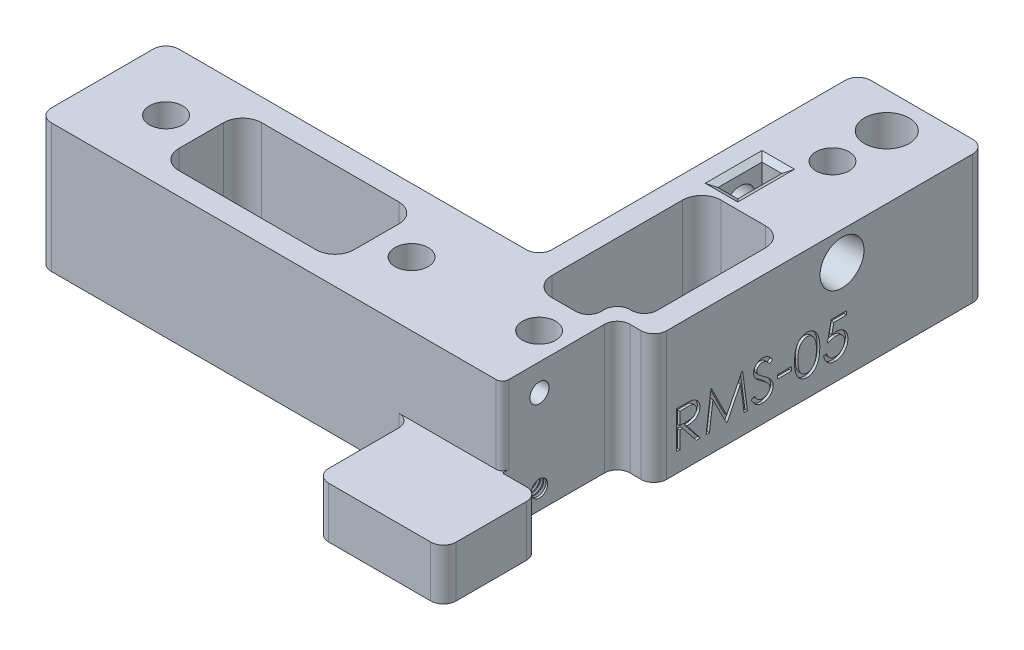
from build123d import *
from build123d.topology import SkipClean

# Parameters (mm, degrees)
SKETCH1_R                       = 2.6
BOSS_EXTRUDE1_DEPTH             = 10
SKETCH4_R                       = 2.4
MOTOR_TENSIONING_HOLE_DEPTH     = 106.651549918
SKETCH10_W                      = 20
SKETCH10_H                      = 15
BOSS_EXTRUDE3_DEPTH             = 10
FILLET1_R                       = 2
CHAMFER2_SIZE                   = 12
CHAMFER2_SIZE2                  = 1.049863962
CUT_EXTRUDE8_START              = -4
CUT_EXTRUDE8_DEPTH              = 3.1
CHAMFER3_SIZE                   = 1
CHAMFER3_SIZE2                  = 0.577350269
SKETCH6_R                       = 3.5
M3_SCREWHEAD_CLEARANCE_DEPTH    = 106.651549918
SKETCH2_R                       = 2.6
HEIGHT_BUMP_DEPTH               = 10.2
SKETCH12_W                      = 18
SKETCH12_H                      = 20.2
LIMIT_SWITCH_CUTOUT_DEPTH       = 5.75
SKETCH3_R                       = 1.5
SKETCH3_R_2                     = 1.3
D2HW_LIMIT_SWITCH_HOLES_DEPTH   = 7
SKETCH8_W                       = 2.238782051
SKETCH8_H                       = 0.597008547
RIGHT_SIDE_PART_NUM_SHORT_DEPTH = 0.4
SKETCH11_W                      = 22.169940191
SKETCH11_H                      = 15
CUT_EXTRUDE4_DEPTH              = 12.2
FILLET2_R                       = 2
FILLET3_R                       = 1
SKETCH18_W                      = 27.5
SKETCH18_H                      = 13
CUT_EXTRUDE9_DEPTH              = 174.081021592
FILLET5_R                       = 3
FILLET6_R                       = 2
THREAD1_PITCH                   = 0.5


with BuildPart() as part:
    # Sketch1 → Boss-Extrude1 (new body)
    with BuildSketch(Plane(origin=(0, 0, 0), x_dir=(1, 0, 0), z_dir=(0, 1, 0))):
        Polygon((0, 0), (78.5, 0), (78.5, 20), (20, 20), (20, 70), (0, 70), align=None)
        with Locations(Location((10, 56, 0), (0, 0, 270))):
            Circle(SKETCH1_R, mode=Mode.SUBTRACT)
        with Locations(Location((68.5, 10, 0), (0, 0, 270))):
            Circle(SKETCH1_R, mode=Mode.SUBTRACT)
        with Locations(Location((10, 10, 0), (0, 0, 270))):
            Circle(SKETCH1_R, mode=Mode.SUBTRACT)
        with Locations(Location((30, 10, 0), (0, 0, 270))):
            Circle(SKETCH1_R, mode=Mode.SUBTRACT)
    extrude(amount=BOSS_EXTRUDE1_DEPTH)

    # Sketch4 → motor tensioning hole (cut, through all)
    with BuildSketch(Plane.ZY):
        with Locations((-47.5, 5.5)):
            Circle(SKETCH4_R)
    extrude(amount=-MOTOR_TENSIONING_HOLE_DEPTH, mode=Mode.SUBTRACT)

    # Sketch10 → Boss-Extrude3 (add)
    with BuildSketch(Plane(origin=(0, 10, 0), x_dir=(1, 0, 0), z_dir=(0, 1, 0))):
        with Locations((10, -7.5)):
            Rectangle(SKETCH10_W, SKETCH10_H)
    extrude(amount=-BOSS_EXTRUDE3_DEPTH)

    # Fillet1
    fillet1_edges = [part.edges().sort_by_distance(p)[0] for p in [
        (0, 5, -70),
        (20, 5, -70),
        (20, 5, -20),
        (78.5, 5, -20),
        (78.5, 5, 0),
        (0, 5, 15),
        (20, 5, 0),
        (20, 5, 15),
    ]]
    fillet(fillet1_edges, radius=FILLET1_R)

    # Chamfer2
    chamfer2_edges = [part.edges().sort_by_distance(p)[0] for p in [
        (0, 5.5, -49.9),
    ]]
    chamfer2_side = [part.faces().sort_by_distance(p)[0] for p in [
        (10, 5.5, -49.9),
    ]]
    chamfer(chamfer2_edges, length=CHAMFER2_SIZE, length2=CHAMFER2_SIZE2, reference=chamfer2_side[0])

    # Sketch17 → Cut-Extrude8 (cut)
    with BuildSketch(Plane(origin=(20, 0, 0), x_dir=(0, 0, -1), z_dir=(1, 0, 0)).offset(CUT_EXTRUDE8_START)):
        Polygon((44.05, 7.491858429), (44.05, 10), (50.95, 10), (50.95, 7.491858429), (50.95, 3.508141571), (47.5, 1.516283143), (44.05, 3.508141571), align=None)
    extrude(amount=-CUT_EXTRUDE8_DEPTH, mode=Mode.SUBTRACT)

    # Chamfer3
    chamfer3_edges = [part.edges().sort_by_distance(p)[0] for p in [
        (16, 10, -47.5),
        (14.45, 10, -50.95),
        (12.9, 10, -47.5),
        (14.45, 10, -44.05),
    ]]
    chamfer3_side = [part.faces().sort_by_distance(p)[0] for p in [
        (49.25, 10, -1.157032843),
    ]]
    chamfer(chamfer3_edges, length=CHAMFER3_SIZE, length2=CHAMFER3_SIZE2, reference=chamfer3_side[0])

    # Sketch6 → M3 Screwhead Clearance (cut, through all)
    with BuildSketch(Plane(origin=(0, 10, 0), x_dir=(1, 0, 0), z_dir=(0, 1, 0))):
        with Locations(Location((9.89945477, 64.41665231, 0), (0, 0, 270))):
            Circle(SKETCH6_R)
    extrude(amount=-M3_SCREWHEAD_CLEARANCE_DEPTH, mode=Mode.SUBTRACT)


with BuildPart() as body_2:
    # Mirror1: mirrored copy
    add(part.part.mirror(Plane(origin=(78.5, 10, 0), x_dir=(0, 0, 1), z_dir=(-1, 0, 0))))

    # Sketch2 → height bump (add)
    with BuildSketch(Plane(origin=(0, 0, 0), x_dir=(1, 0, 0), z_dir=(0, 1, 0))):
        with BuildLine():
            Line((157, -13), (157, 68))
            ThreePointArc((157, 68), (156.414213562, 69.414213562), (155, 70))
            Line((155, 70), (139, 70))
            ThreePointArc((139, 70), (137.585786438, 69.414213562), (137, 68))
            Line((137, 68), (137, 22))
            ThreePointArc((137, 22), (136.414213562, 20.585786438), (135, 20))
            Line((135, 20), (80.5, 20))
            ThreePointArc((80.5, 20), (79.085786438, 19.414213562), (78.5, 18))
            Line((78.5, 18), (78.5, 2))
            ThreePointArc((78.5, 2), (79.085786438, 0.585786438), (80.5, 0))
            Line((80.5, 0), (135, 0))
            ThreePointArc((135, 0), (136.414213562, -0.585786438), (137, -2))
            Line((137, -2), (137, -13))
            ThreePointArc((137, -13), (137.585786438, -14.414213562), (139, -15))
            Line((139, -15), (155, -15))
            ThreePointArc((155, -15), (156.414213562, -14.414213562), (157, -13))
        make_face()
        with Locations(Location((147, 10, 0), (0, 0, 270))):
            Circle(SKETCH2_R, mode=Mode.SUBTRACT)
        with Locations(Location((88.5, 10, 0), (0, 0, 270))):
            Circle(SKETCH2_R, mode=Mode.SUBTRACT)
        with Locations(Location((147, 56, 0), (0, 0, 270))):
            Circle(SKETCH2_R, mode=Mode.SUBTRACT)
        with Locations(Location((127, 10, 0), (0, 0, 270))):
            Circle(SKETCH2_R, mode=Mode.SUBTRACT)
    extrude(amount=-HEIGHT_BUMP_DEPTH)

    # Sketch12 → Limit Switch Cutout (cut)
    with BuildSketch(Plane(origin=(157, 0, 0), x_dir=(0, 0, -1), z_dir=(1, 0, 0))):
        with Locations((9, -0.1)):
            Rectangle(SKETCH12_W, SKETCH12_H)
    extrude(amount=-LIMIT_SWITCH_CUTOUT_DEPTH, mode=Mode.SUBTRACT)

    # Sketch3 → d2hw limit switch holes (cut)
    with BuildSketch(Plane(origin=(151.25, 0, 0), x_dir=(0, 0, -1), z_dir=(1, 0, 0))):
        with Locations((5.8, 5.8)):
            Circle(SKETCH3_R)
        with Locations((5.8, -7.2)):
            Circle(SKETCH3_R_2)
    extrude(amount=-D2HW_LIMIT_SWITCH_HOLES_DEPTH, mode=Mode.SUBTRACT)

    # Sketch8 → Right Side Part Num Short (cut)
    # profile 1 of 6: a face of its own
    with BuildSketch(Plane(origin=(157, 0, 0), x_dir=(0, 0, -1), z_dir=(1, 0, 0))):
        with BuildLine():
            Line((21.552144353, -1.379166667), (22.717010639, -1.379166667))
            add(Edge.make_bspline(
                [(22.717010639, -1.379166667), (22.794745587, -1.379425421), (22.944005299, -1.379922258), (23.157834892, -1.38269258), (23.352129481, -1.390632789), (23.526787476, -1.397465754), (23.681805672, -1.409925566), (23.817659416, -1.421834404), (23.933723004, -1.437423695), (24.003981878, -1.451901642), (24.035793191, -1.458456864)],
                knots=[0, 0, 0, 0, 1.410062039, 2.707475311, 3.878576406, 4.937260626, 5.877586885, 6.699081471, 7.410979367, 8, 8, 8, 8], degree=3))
            add(Edge.make_bspline(
                [(24.035793191, -1.458456864), (24.078379446, -1.468978878), (24.162643475, -1.489798441), (24.283966382, -1.533803277), (24.399575323, -1.584726629), (24.508990067, -1.644537721), (24.611662567, -1.713680539), (24.708651472, -1.790961453), (24.800396891, -1.875957603), (24.883188484, -1.970811976), (24.961252597, -2.070325791), (25.027092253, -2.177934301), (25.083847839, -2.290461865), (25.129034996, -2.409052892), (25.16542015, -2.532557291), (25.191075455, -2.662093778), (25.206461061, -2.797072209), (25.208027457, -2.889137684), (25.208821703, -2.935819812)],
                knots=[0, 0, 0, 0, 1.027469482, 2.033020251, 3.019912614, 3.986113645, 4.951240523, 5.91722682, 6.890402269, 7.87763091, 8.8651537, 9.85103654, 10.82876324, 11.815024772, 12.821070561, 13.842952187, 14.906261191, 16, 16, 16, 16], degree=3))
            add(Edge.make_bspline(
                [(25.208821703, -2.935819812), (25.206378619, -3.013378432), (25.20161153, -3.164715389), (25.157165138, -3.384345212), (25.084360616, -3.589220774), (24.984037241, -3.779084114), (24.856279137, -3.950234318), (24.702734217, -4.100562254), (24.523316822, -4.226358632), (24.356293305, -4.313592642), (24.208753142, -4.369460848), (24.087291787, -4.408770364), (23.954798017, -4.439141752), (23.812541283, -4.466350209), (23.659929584, -4.486892253), (23.497328697, -4.501937601), (23.324622657, -4.511340823), (23.205978991, -4.512741157), (23.1449445, -4.513461538)],
                knots=[0, 0, 0, 0, 1.260483769, 2.459530307, 3.627416485, 4.787058657, 5.939039949, 7.08810263, 8.267026773, 9.491475466, 10.141966685, 10.831826277, 11.566392101, 12.351337768, 13.187381173, 14.07005841, 15.007169909, 16, 16, 16, 16], degree=3))
            Line((23.1449445, -4.513461538), (25.283447772, -7.2))
            Line((25.283447772, -7.2), (24.637465867, -7.2))
            Line((24.637465867, -7.2), (22.498962595, -4.513461538))
            Line((22.498962595, -4.513461538), (22.074526831, -4.513461538))
            Line((22.074526831, -4.513461538), (22.074526831, -7.2))
            Line((22.074526831, -7.2), (21.552144353, -7.2))
            Line((21.552144353, -7.2), (21.552144353, -1.379166667))
        make_face()
        with BuildLine():
            Line((22.074526831, -1.976175214), (22.074526831, -3.916452991))
            Line((22.074526831, -3.916452991), (23.14028037, -3.924615218))
            add(Edge.make_bspline(
                [(23.14028037, -3.924615218), (23.190040245, -3.924637231), (23.286489053, -3.924679901), (23.42602385, -3.91803787), (23.555945035, -3.910481899), (23.675755667, -3.898924476), (23.785509268, -3.884029676), (23.88515098, -3.865398046), (23.974843456, -3.843691223), (24.079449716, -3.810093995), (24.196259756, -3.756864938), (24.323206244, -3.679422079), (24.431311322, -3.582016056), (24.522644957, -3.47063282), (24.596036405, -3.348168725), (24.647778714, -3.21609174), (24.680612276, -3.07773619), (24.684484869, -2.982643551), (24.686439225, -2.934653779)],
                knots=[0, 0, 0, 0, 1.146690395, 2.22261258, 3.21895312, 4.145990853, 4.996080663, 5.770904154, 6.481378293, 7.121626537, 8.300444488, 9.431385265, 10.535395872, 11.636531494, 12.74115979, 13.810798291, 14.895190096, 16, 16, 16, 16], degree=3))
            add(Edge.make_bspline(
                [(24.686439225, -2.934653779), (24.684439983, -2.887843347), (24.680478215, -2.79508215), (24.648133061, -2.659280594), (24.593434887, -2.531110916), (24.519722784, -2.411094505), (24.429917047, -2.302152228), (24.324613494, -2.208940474), (24.206691402, -2.13202321), (24.096476087, -2.08287146), (23.99796395, -2.052736419), (23.912431528, -2.031530019), (23.815786606, -2.014492491), (23.707559921, -2.000841704), (23.588213494, -1.98910866), (23.457143876, -1.981206), (23.315220683, -1.976526276), (23.216853703, -1.976294958), (23.165933081, -1.976175214)],
                knots=[0, 0, 0, 0, 1.101028733, 2.181837193, 3.264309656, 4.369019818, 5.486613113, 6.575447106, 7.666700264, 8.788928104, 9.402425223, 10.0903467, 10.862060571, 11.710948788, 12.657782767, 13.684531032, 14.801375019, 16, 16, 16, 16], degree=3))
            Line((23.165933081, -1.976175214), (22.074526831, -1.976175214))
        make_face(mode=Mode.SUBTRACT)
    # profile 2 of 6: a face of its own
    with BuildSketch(Plane(origin=(157, 0, 0), x_dir=(0, 0, -1), z_dir=(1, 0, 0))):
        Polygon((26.178960592, -7.2), (26.94737589, -1.379166667), (27.022001958, -1.379166667), (29.425194566, -6.155235043), (31.822557013, -1.379166667), (31.898349114, -1.379166667), (32.671428541, -7.2), (32.146713998, -7.2), (31.589350549, -3.011611912), (29.488160312, -7.2), (29.370391048, -7.2), (27.261038584, -3.002283654), (26.704841168, -7.2), align=None)
    # profile 3 of 6: a face of its own
    with BuildSketch(Plane(origin=(157, 0, 0), x_dir=(0, 0, -1), z_dir=(1, 0, 0))):
        with BuildLine():
            Line((33.268437088, -6.077110877), (33.760502726, -5.782104701))
            add(Edge.make_bspline(
                [(33.760502726, -5.782104701), (33.806268176, -5.85871416), (33.89395301, -6.005494928), (34.040224497, -6.203832407), (34.191787208, -6.372407327), (34.349763516, -6.510239018), (34.513189146, -6.618754131), (34.683130959, -6.695592843), (34.859016271, -6.743516554), (34.978715591, -6.749337531), (35.038474147, -6.75224359)],
                knots=[0, 0, 0, 0, 1.272034388, 2.437168799, 3.508375237, 4.49857839, 5.41946034, 6.295179144, 7.148887113, 8, 8, 8, 8], degree=3))
            add(Edge.make_bspline(
                [(35.038474147, -6.75224359), (35.089509319, -6.750822188), (35.190686666, -6.748004256), (35.339637206, -6.720927731), (35.484296227, -6.679330179), (35.621682259, -6.619756558), (35.749899609, -6.547680529), (35.862335982, -6.46062385), (35.959537434, -6.363156149), (36.039048545, -6.254418567), (36.100050937, -6.137474452), (36.146937032, -6.017438971), (36.172956279, -5.892426483), (36.176875785, -5.808256463), (36.178853755, -5.765780248)],
                knots=[0, 0, 0, 0, 1.095163259, 2.171163733, 3.241058638, 4.321873601, 5.38011039, 6.391990106, 7.366004449, 8.327778327, 9.272591725, 10.192022065, 11.087607919, 12, 12, 12, 12], degree=3))
            add(Edge.make_bspline(
                [(36.178853755, -5.765780248), (36.176401835, -5.71731624), (36.171417442, -5.618795993), (36.129288778, -5.473442046), (36.063015686, -5.329596665), (36.001875908, -5.240618965), (35.97013397, -5.194424412)],
                knots=[0, 0, 0, 0, 0.938893495, 1.908633276, 2.914225137, 4, 4, 4, 4], degree=3))
            add(Edge.make_bspline(
                [(35.97013397, -5.194424412), (35.944072246, -5.161084636), (35.889358917, -5.091091944), (35.795298387, -4.986906952), (35.684925218, -4.879440367), (35.562016568, -4.764588578), (35.422095228, -4.647693278), (35.269543636, -4.523180201), (35.100466956, -4.395784483), (34.981889103, -4.310347014), (34.920704883, -4.266262687)],
                knots=[0, 0, 0, 0, 0.722233717, 1.516239348, 2.393582979, 3.351407094, 4.387010283, 5.505090956, 6.712668013, 8, 8, 8, 8], degree=3))
            add(Edge.make_bspline(
                [(34.920704883, -4.266262687), (34.85946307, -4.222642048), (34.742373388, -4.139242707), (34.578627388, -4.015468035), (34.432201061, -3.9023046), (34.303745221, -3.798687094), (34.193316367, -3.704601464), (34.100044314, -3.620951201), (34.02630507, -3.545474017), (33.985300492, -3.496510262), (33.966890447, -3.474526743)],
                knots=[0, 0, 0, 0, 1.452282411, 2.77665338, 3.964542531, 5.026858415, 5.96415736, 6.766646006, 7.446254459, 8, 8, 8, 8], degree=3))
            add(Edge.make_bspline(
                [(33.966890447, -3.474526743), (33.94115813, -3.440265256), (33.890552077, -3.372885446), (33.823752184, -3.267570176), (33.766975505, -3.159762912), (33.722467198, -3.049173956), (33.68498732, -2.937355866), (33.659778238, -2.822849688), (33.643993141, -2.706169223), (33.642376634, -2.627648675), (33.64156743, -2.588342181)],
                knots=[0, 0, 0, 0, 1.068054152, 2.10047183, 3.106115577, 4.101338837, 5.06977816, 6.043150881, 7.020423561, 8, 8, 8, 8], degree=3))
            add(Edge.make_bspline(
                [(33.64156743, -2.588342181), (33.643738117, -2.526758139), (33.648033093, -2.404906371), (33.684355954, -2.226903907), (33.741687659, -2.056958163), (33.822006657, -1.896751644), (33.925546564, -1.75045584), (34.045365881, -1.616387933), (34.188078555, -1.503682327), (34.344663335, -1.405207035), (34.516055896, -1.328129347), (34.695655053, -1.269985907), (34.883746255, -1.237041225), (35.011144564, -1.232313437), (35.075787181, -1.22991453)],
                knots=[0, 0, 0, 0, 1.005424448, 1.989358655, 2.955360095, 3.929531133, 4.905563448, 5.876582895, 6.856512386, 7.866279853, 8.892233794, 9.918561126, 10.94386622, 12, 12, 12, 12], degree=3))
            add(Edge.make_bspline(
                [(35.075787181, -1.22991453), (35.144380048, -1.232280369), (35.280789368, -1.236985267), (35.481440504, -1.277893304), (35.674626838, -1.345582398), (35.830031887, -1.422398535), (35.951658634, -1.499119473), (36.044414, -1.569002442), (36.138407903, -1.649454855), (36.234398526, -1.740691006), (36.33075936, -1.843548043), (36.428920983, -1.957321534), (36.529112939, -2.081316187), (36.593567626, -2.169833601), (36.626610165, -2.215211839)],
                knots=[0, 0, 0, 0, 1.286793592, 2.559021753, 3.825965368, 5.121522368, 5.803751409, 6.523245864, 7.299691795, 8.125521123, 9.008227632, 9.944561021, 10.946284179, 12, 12, 12, 12], degree=3))
            Line((36.626610165, -2.215211839), (36.154367076, -2.573183761))
            add(Edge.make_bspline(
                [(36.154367076, -2.573183761), (36.125851757, -2.536448165), (36.070937921, -2.465703996), (35.98756781, -2.366631225), (35.908988808, -2.276131437), (35.83157106, -2.197525028), (35.759403318, -2.126507313), (35.689358666, -2.065704956), (35.622445108, -2.014522209), (35.538098055, -1.959900241), (35.432129421, -1.905755675), (35.29910752, -1.859938935), (35.160095584, -1.83240629), (35.065416185, -1.828765961), (35.017485565, -1.826923077)],
                knots=[0, 0, 0, 0, 1.181633172, 2.275549214, 3.290209073, 4.226197932, 5.078386478, 5.862611352, 6.581680152, 7.217281963, 8.414376989, 9.595101626, 10.782541182, 12, 12, 12, 12], degree=3))
            add(Edge.make_bspline(
                [(35.017485565, -1.826923077), (34.957353825, -1.828938249), (34.841395429, -1.83282432), (34.676765238, -1.875266486), (34.528593556, -1.942092746), (34.401279349, -2.035749918), (34.295278686, -2.146713283), (34.218600918, -2.274403831), (34.172449751, -2.415405041), (34.166818045, -2.513763249), (34.163949908, -2.563855502)],
                knots=[0, 0, 0, 0, 1.14458467, 2.207223713, 3.21896685, 4.227309161, 5.202851033, 6.127160689, 7.046193047, 8, 8, 8, 8], degree=3))
            add(Edge.make_bspline(
                [(34.163949908, -2.563855502), (34.164603715, -2.595040997), (34.165912399, -2.657462981), (34.184164532, -2.749683976), (34.207613059, -2.841672002), (34.244770984, -2.933013488), (34.296069661, -3.025305892), (34.363433626, -3.120138472), (34.448273623, -3.218347088), (34.513262416, -3.282222208), (34.547574541, -3.315946347)],
                knots=[0, 0, 0, 0, 0.858281714, 1.717966888, 2.583508476, 3.4729293, 4.427298488, 5.488583878, 6.674047936, 8, 8, 8, 8], degree=3))
            add(Edge.make_bspline(
                [(34.547574541, -3.315946347), (34.560316133, -3.327316973), (34.590587239, -3.354330975), (34.645928273, -3.39855647), (34.719009331, -3.453110605), (34.807922063, -3.520611177), (34.914305878, -3.598912133), (35.038172473, -3.687012295), (35.178141118, -3.787771683), (35.277464352, -3.858216307), (35.329982227, -3.89546441)],
                knots=[0, 0, 0, 0, 0.420754252, 0.999615792, 1.744751191, 2.668019286, 3.750313428, 4.999500688, 6.413464383, 8, 8, 8, 8], degree=3))
            add(Edge.make_bspline(
                [(35.329982227, -3.89546441), (35.393156418, -3.941434623), (35.515484484, -4.03044957), (35.689540007, -4.164188505), (35.847357448, -4.294987234), (35.989490894, -4.422010469), (36.117344515, -4.54429469), (36.229499867, -4.663311075), (36.327099742, -4.778206961), (36.4321728, -4.92551159), (36.539538602, -5.106424894), (36.631743109, -5.328079297), (36.68988217, -5.550595321), (36.697485036, -5.700152214), (36.701236233, -5.773942475)],
                knots=[0, 0, 0, 0, 1.163667725, 2.253281268, 3.268753668, 4.215851969, 5.092017293, 5.902905408, 6.650798638, 7.335211899, 8.59617414, 9.77448103, 10.901945474, 12, 12, 12, 12], degree=3))
            add(Edge.make_bspline(
                [(36.701236233, -5.773942475), (36.70014335, -5.826127684), (36.697978806, -5.929484702), (36.673097382, -6.081250586), (36.636642891, -6.228652163), (36.581698825, -6.36986743), (36.514637572, -6.507479851), (36.429543229, -6.637879656), (36.330908901, -6.763952917), (36.217762271, -6.882337842), (36.093951645, -6.99101479), (35.963093167, -7.087688955), (35.824972654, -7.168296393), (35.680339386, -7.23407321), (35.529160143, -7.285518596), (35.371485769, -7.322793332), (35.207056356, -7.345670389), (35.095295555, -7.348044892), (35.038474147, -7.349252137)],
                knots=[0, 0, 0, 0, 0.983748083, 1.948392443, 2.894712957, 3.844097841, 4.80183111, 5.778335162, 6.776009319, 7.81870978, 8.863265674, 9.881300176, 10.883814829, 11.87499822, 12.874611388, 13.892143829, 14.928324115, 16, 16, 16, 16], degree=3))
            add(Edge.make_bspline(
                [(35.038474147, -7.349252137), (34.994509654, -7.348401993), (34.907134356, -7.346712412), (34.777896086, -7.331775688), (34.651268698, -7.310642564), (34.528841136, -7.277091165), (34.40903606, -7.236383621), (34.292374528, -7.186260703), (34.178800002, -7.126194357), (34.067675998, -7.057516799), (33.959285138, -6.977592192), (33.854644071, -6.884502937), (33.750319461, -6.780816425), (33.649390541, -6.663716952), (33.5498158, -6.535096355), (33.453558493, -6.393751248), (33.35862616, -6.24045153), (33.299061626, -6.132574715), (33.268437088, -6.077110877)],
                knots=[0, 0, 0, 0, 0.915332311, 1.819136955, 2.706846663, 3.586547465, 4.459518054, 5.340707479, 6.227863349, 7.133153174, 8.059268498, 9.028702269, 10.047606654, 11.120612155, 12.245963614, 13.433783089, 14.680604001, 16, 16, 16, 16], degree=3))
        make_face()
    # profile 4 of 6: a face of its own
    with BuildSketch(Plane(origin=(157, 0, 0), x_dir=(0, 0, -1), z_dir=(1, 0, 0))):
        with Locations((38.492261875, -4.961217948)):
            Rectangle(SKETCH8_W, SKETCH8_H)
    # profile 5 of 6: a face of its own
    with BuildSketch(Plane(origin=(157, 0, 0), x_dir=(0, 0, -1), z_dir=(1, 0, 0))):
        with BuildLine():
            add(Edge.make_bspline(
                [(40.05940931, -4.291915398), (40.059954836, -4.1986201), (40.061014527, -4.017392638), (40.072803246, -3.753318656), (40.092386761, -3.505583508), (40.119224749, -3.274175338), (40.151884581, -3.059034403), (40.195483432, -2.860735646), (40.245064962, -2.678361277), (40.30252897, -2.511316584), (40.367369376, -2.357351047), (40.437941593, -2.213617706), (40.517046376, -2.08033404), (40.600162742, -1.955372739), (40.690655199, -1.840779332), (40.785948545, -1.734935523), (40.88976207, -1.640287525), (40.998566764, -1.554062187), (41.113347717, -1.478475387), (41.230833198, -1.41189713), (41.351831869, -1.355019493), (41.47667408, -1.310298138), (41.604237739, -1.273359384), (41.734968777, -1.248098718), (41.869083045, -1.232204669), (41.959607705, -1.230685152), (42.005517249, -1.22991453)],
                knots=[0, 0, 0, 0, 1.646270934, 3.197905019, 4.663502075, 6.030701355, 7.308322542, 8.50163776, 9.611534131, 10.641858119, 11.616356847, 12.558055219, 13.465016945, 14.349605745, 15.204443733, 16.039544428, 16.859896111, 17.680448484, 18.487036065, 19.28249412, 20.06191084, 20.843045899, 21.620316918, 22.403196591, 23.190181807, 24, 24, 24, 24], degree=3))
            add(Edge.make_bspline(
                [(42.005517249, -1.22991453), (42.051810301, -1.230725813), (42.143872616, -1.2323392), (42.279980954, -1.247845804), (42.412944889, -1.273575755), (42.542197556, -1.310032424), (42.668800658, -1.355261424), (42.791763946, -1.411951546), (42.911851199, -1.477941282), (43.02715407, -1.55548123), (43.138938377, -1.641932706), (43.244458382, -1.739660621), (43.34372369, -1.84767819), (43.437980121, -1.964829718), (43.524553537, -2.093362174), (43.606998876, -2.231040033), (43.680793797, -2.380271007), (43.751865632, -2.53856519), (43.813212204, -2.710302489), (43.868537138, -2.894514835), (43.913239423, -3.093378096), (43.950474915, -3.305848899), (43.979321129, -3.532707535), (44.000330416, -3.773467705), (44.011428392, -4.028287807), (44.013518406, -4.202510087), (44.014590934, -4.291915398)],
                knots=[0, 0, 0, 0, 0.810914788, 1.612654377, 2.396697861, 3.181598691, 3.963628158, 4.749916497, 5.551656086, 6.361998678, 7.18212741, 8.025565596, 8.878627764, 9.750805457, 10.657531673, 11.591944965, 12.560506719, 13.57287815, 14.630710178, 15.753379473, 16.941251878, 18.199788006, 19.531962791, 20.947069417, 22.433333509, 24, 24, 24, 24], degree=3))
            add(Edge.make_bspline(
                [(44.014590934, -4.291915398), (44.013507287, -4.380930754), (44.011395845, -4.554373546), (44.000454829, -4.808047085), (43.978903391, -5.047529545), (43.951944637, -5.273395278), (43.914606547, -5.484704199), (43.868696526, -5.682187526), (43.81772212, -5.866698083), (43.754799255, -6.036724312), (43.685929299, -6.19463807), (43.610998217, -6.342099982), (43.530720899, -6.480413447), (43.443260808, -6.60847136), (43.350038643, -6.727180865), (43.249059178, -6.834446554), (43.143168931, -6.932853016), (43.031055663, -7.020417687), (42.913954548, -7.097061106), (42.794279749, -7.165603665), (42.669907861, -7.220872802), (42.543657391, -7.268329292), (42.413722477, -7.30458552), (42.280265087, -7.329654777), (42.143964061, -7.347236768), (42.051825982, -7.348578021), (42.005517249, -7.349252137)],
                knots=[0, 0, 0, 0, 1.561518951, 3.042555995, 4.452378317, 5.7783523, 7.031515105, 8.214008947, 9.334062868, 10.386615937, 11.391082383, 12.354592575, 13.286541444, 14.194233754, 15.072674879, 15.931287219, 16.775624067, 17.606195743, 18.42308326, 19.229000347, 20.022332153, 20.807536673, 21.593273796, 22.3848459, 23.188221202, 24, 24, 24, 24], degree=3))
            add(Edge.make_bspline(
                [(42.005517249, -7.349252137), (41.959608979, -7.348476543), (41.86908683, -7.346947224), (41.734954166, -7.331124983), (41.604763007, -7.305687104), (41.477870912, -7.270069252), (41.353626863, -7.226471482), (41.233723872, -7.169670654), (41.11682876, -7.104254351), (41.003253398, -7.029755299), (40.895131983, -6.944402452), (40.791856088, -6.849998034), (40.696020193, -6.744186242), (40.606821584, -6.628637838), (40.522046821, -6.504415863), (40.444065327, -6.369824271), (40.371935466, -6.225396739), (40.306004566, -6.070200166), (40.247548991, -5.901969887), (40.195913695, -5.718781313), (40.155144317, -5.519017571), (40.120247664, -5.304283092), (40.092100803, -5.073655139), (40.072884859, -4.827008505), (40.061008172, -4.56449689), (40.05995199, -4.384433944), (40.05940931, -4.291915398)],
                knots=[0, 0, 0, 0, 0.810891512, 1.598919785, 2.382837074, 3.152667961, 3.926044502, 4.706494248, 5.493654104, 6.291793342, 7.103789334, 7.925228297, 8.761435821, 9.622817696, 10.50288917, 11.416980706, 12.369136599, 13.353924996, 14.394355917, 15.514179734, 16.714354668, 17.994756427, 19.357759367, 20.818452758, 22.365282078, 24, 24, 24, 24], degree=3))
        make_face()
        with BuildLine():
            add(Edge.make_bspline(
                [(40.581791789, -4.289583333), (40.581990441, -4.367330872), (40.582375985, -4.518223577), (40.592448023, -4.737491477), (40.606168945, -4.942002845), (40.623866435, -5.132017357), (40.650148244, -5.306891842), (40.679596318, -5.467829042), (40.715432844, -5.613977256), (40.757833486, -5.746339365), (40.80612827, -5.867161685), (40.858858141, -5.979588944), (40.915504367, -6.084949248), (40.978900145, -6.182296213), (41.047943649, -6.271947298), (41.121075367, -6.355489282), (41.201024653, -6.429990928), (41.31162671, -6.519343805), (41.457640609, -6.611677412), (41.641612961, -6.692081564), (41.830654421, -6.742610483), (41.958964297, -6.749036277), (42.023007734, -6.75224359)],
                knots=[0, 0, 0, 0, 1.459021318, 2.831673884, 4.118529203, 5.306027144, 6.411944654, 7.436330062, 8.375795394, 9.233974572, 10.042671642, 10.816086306, 11.563610507, 12.285937304, 12.993564865, 13.685989202, 14.367179055, 15.041617293, 16.353048772, 17.594441528, 18.799311195, 20, 20, 20, 20], degree=3))
            add(Edge.make_bspline(
                [(42.023007734, -6.75224359), (42.087465433, -6.749586328), (42.216247751, -6.744277291), (42.404400027, -6.693056058), (42.587058226, -6.615772788), (42.73020406, -6.524389853), (42.839107766, -6.437362858), (42.917135189, -6.363164448), (42.988751477, -6.280083083), (43.056675737, -6.190443421), (43.118973747, -6.092532873), (43.175623989, -5.986822257), (43.227318557, -5.873018017), (43.256770387, -5.793572391), (43.271828347, -5.752953893)],
                knots=[0, 0, 0, 0, 1.353760809, 2.704726607, 4.075137775, 5.516104923, 6.260822281, 7.007110065, 7.778089737, 8.566572457, 9.372053459, 10.217411131, 11.088608312, 12, 12, 12, 12], degree=3))
            add(Edge.make_bspline(
                [(43.271828347, -5.752953893), (43.289376942, -5.701015862), (43.325008115, -5.595559385), (43.370929126, -5.431971264), (43.407093795, -5.260335238), (43.439629536, -5.081677038), (43.461836939, -4.894679107), (43.479711577, -4.699920037), (43.490240112, -4.497252986), (43.491545228, -4.359557031), (43.492208455, -4.289583333)],
                knots=[0, 0, 0, 0, 0.884706709, 1.796334032, 2.740027952, 3.714592787, 4.726048262, 5.777819803, 6.87074269, 8, 8, 8, 8], degree=3))
            add(Edge.make_bspline(
                [(43.492208455, -4.289583333), (43.491293438, -4.219620954), (43.489503469, -4.082759583), (43.482661516, -3.882326371), (43.4649935, -3.691955583), (43.445370441, -3.510827094), (43.416437206, -3.339943555), (43.385241186, -3.177874417), (43.34332917, -3.026627505), (43.298559021, -2.883834844), (43.247318399, -2.751118755), (43.190913303, -2.62786047), (43.130673068, -2.513464922), (43.065243175, -2.408245973), (42.995400355, -2.311732327), (42.919301193, -2.225859078), (42.839964277, -2.14796474), (42.728840934, -2.059051396), (42.583362859, -1.968393254), (42.402342181, -1.884962818), (42.213962312, -1.837051884), (42.086613365, -1.830296911), (42.023007734, -1.826923077)],
                knots=[0, 0, 0, 0, 1.31362396, 2.569729283, 3.763502607, 4.902122613, 5.988968491, 7.01645872, 7.998833611, 8.933434873, 9.825090667, 10.667526885, 11.477055099, 12.250526234, 12.991942729, 13.710640831, 14.402115721, 15.076753259, 16.378508321, 17.609869233, 18.806226677, 20, 20, 20, 20], degree=3))
            add(Edge.make_bspline(
                [(42.023007734, -1.826923077), (41.958628333, -1.830301566), (41.829752246, -1.837064699), (41.639414398, -1.884784313), (41.456965613, -1.967960638), (41.311872237, -2.059351667), (41.200671392, -2.146395264), (41.122368389, -2.221877259), (41.0489491, -2.304443709), (40.981314842, -2.394919274), (40.917968736, -2.492152748), (40.859791981, -2.596909063), (40.80737566, -2.709719082), (40.759005306, -2.83048713), (40.716475324, -2.962837819), (40.681394055, -3.108806015), (40.648985229, -3.269231328), (40.626042383, -3.445052938), (40.60564659, -3.635115043), (40.592539157, -3.840136964), (40.582342292, -4.059772606), (40.581978965, -4.211445492), (40.581791789, -4.289583333)],
                knots=[0, 0, 0, 0, 1.207732386, 2.417664972, 3.655092373, 4.956220595, 5.625982001, 6.301752483, 6.994047911, 7.697131622, 8.419323945, 9.170223765, 9.943494443, 10.752040957, 11.610060368, 12.549350801, 13.567764191, 14.679664412, 15.874934091, 17.154273443, 18.533957287, 20, 20, 20, 20], degree=3))
        make_face(mode=Mode.SUBTRACT)
    # profile 6 of 6: a face of its own
    with BuildSketch(Plane(origin=(157, 0, 0), x_dir=(0, 0, -1), z_dir=(1, 0, 0))):
        with BuildLine():
            Line((48.193650763, -1.379166667), (48.193650763, -1.976175214))
            Line((48.193650763, -1.976175214), (46.213727886, -1.976175214))
            Line((46.213727886, -1.976175214), (45.900065193, -3.507175648))
            add(Edge.make_bspline(
                [(45.900065193, -3.507175648), (45.961692641, -3.490161731), (46.081086075, -3.457199959), (46.257307415, -3.420602267), (46.42460183, -3.398540571), (46.533160987, -3.395528189), (46.585692196, -3.394070513)],
                knots=[0, 0, 0, 0, 1.100273476, 2.13160584, 3.095893838, 4, 4, 4, 4], degree=3))
            add(Edge.make_bspline(
                [(46.585692196, -3.394070513), (46.650692177, -3.395477384), (46.778498381, -3.398243646), (46.965495058, -3.424806352), (47.143999882, -3.466616425), (47.313639538, -3.525025197), (47.474727859, -3.599714361), (47.625782744, -3.693013904), (47.769071558, -3.802002075), (47.902023706, -3.927308006), (48.022638537, -4.065214552), (48.128687451, -4.213492582), (48.218764997, -4.370701087), (48.291210681, -4.5383421), (48.349060342, -4.714562263), (48.387564314, -4.901215737), (48.413203769, -5.096543146), (48.416068262, -5.230097294), (48.417528968, -5.298201289)],
                knots=[0, 0, 0, 0, 1.052922333, 2.070308379, 3.05430497, 4.020497103, 4.973039431, 5.925935799, 6.892292201, 7.88610001, 8.88166317, 9.857072816, 10.836096531, 11.812156883, 12.81219415, 13.836441305, 14.89672472, 16, 16, 16, 16], degree=3))
            add(Edge.make_bspline(
                [(48.417528968, -5.298201289), (48.416422885, -5.345636458), (48.414225665, -5.43986575), (48.403052014, -5.579805569), (48.381538686, -5.716782805), (48.352654507, -5.850815628), (48.315164319, -5.981650286), (48.269780024, -6.109661268), (48.214239249, -6.234051822), (48.153317784, -6.355998937), (48.084720962, -6.472745741), (48.008586945, -6.581926257), (47.928150527, -6.68517833), (47.841600746, -6.781394598), (47.748133139, -6.869942808), (47.64887967, -6.951348462), (47.544632339, -7.026988245), (47.433778323, -7.09379178), (47.318787788, -7.155264696), (47.198000146, -7.205695626), (47.07416491, -7.250783017), (46.945499754, -7.286721719), (46.812296116, -7.31488217), (46.674334423, -7.334008764), (46.532338238, -7.347939577), (46.43608658, -7.348811633), (46.387466702, -7.349252137)],
                knots=[0, 0, 0, 0, 1.056347294, 2.098418968, 3.122841568, 4.141288669, 5.149314143, 6.15115421, 7.162517403, 8.180376062, 9.185164535, 10.17417709, 11.141909838, 12.097768115, 13.052685741, 14.0056014, 14.954263652, 15.917497458, 16.885230207, 17.854509472, 18.828990115, 19.81800267, 20.826176721, 21.857883937, 22.917946725, 24, 24, 24, 24], degree=3))
            add(Edge.make_bspline(
                [(46.387466702, -7.349252137), (46.329467618, -7.348103207), (46.215361272, -7.345842825), (46.048185996, -7.322196129), (45.887340396, -7.288328997), (45.734119263, -7.237377963), (45.587149435, -7.173536236), (45.448409511, -7.092849222), (45.314354428, -7.001413736), (45.190433815, -6.89351153), (45.075420612, -6.775571997), (44.972464192, -6.64758411), (44.880771803, -6.511660265), (44.801811788, -6.367140358), (44.734459721, -6.214404135), (44.681548366, -6.052879335), (44.638842816, -5.883409923), (44.620775913, -5.766737954), (44.611599481, -5.707478632)],
                knots=[0, 0, 0, 0, 1.0467383, 2.05933395, 3.04377827, 4.011590433, 4.970194871, 5.932262533, 6.905835911, 7.896367577, 8.894135286, 9.877477877, 10.858688626, 11.851381753, 12.8477658, 13.868841284, 14.917554742, 16, 16, 16, 16], degree=3))
            Line((44.611599481, -5.707478632), (45.13398196, -5.707478632))
            add(Edge.make_bspline(
                [(45.13398196, -5.707478632), (45.146835287, -5.762986852), (45.171540095, -5.869676731), (45.22576656, -6.019573736), (45.292067308, -6.153152254), (45.370905254, -6.272179287), (45.464953341, -6.375971393), (45.572271926, -6.468467864), (45.69259308, -6.551913883), (45.826294678, -6.621469128), (45.967346906, -6.680789662), (46.11497523, -6.720290992), (46.265159959, -6.748066168), (46.366739105, -6.750846465), (46.417783542, -6.75224359)],
                knots=[0, 0, 0, 0, 1.136247022, 2.183929868, 3.172523383, 4.106158343, 5.02341133, 5.958108904, 6.928429099, 7.938127109, 8.96079061, 9.975095812, 10.982467395, 12, 12, 12, 12], degree=3))
            add(Edge.make_bspline(
                [(46.417783542, -6.75224359), (46.467607288, -6.750878558), (46.565710652, -6.748190799), (46.710086256, -6.727503537), (46.849475048, -6.695642672), (46.98250164, -6.647961972), (47.111493868, -6.590011887), (47.233188817, -6.515646457), (47.351107054, -6.430063546), (47.461583367, -6.332013055), (47.562765165, -6.223962265), (47.652166714, -6.108414743), (47.726634986, -5.985151369), (47.789390402, -5.856306137), (47.837043567, -5.720466918), (47.871038866, -5.57827032), (47.891001096, -5.429365121), (47.893747165, -5.327801043), (47.89514649, -5.276046675)],
                knots=[0, 0, 0, 0, 1.027316725, 2.022795036, 3.002884548, 3.971462791, 4.93288096, 5.914575861, 6.907176829, 7.935150275, 8.956128384, 9.956726525, 10.942570165, 11.921478529, 12.907843606, 13.90538589, 14.932640048, 16, 16, 16, 16], degree=3))
            add(Edge.make_bspline(
                [(47.89514649, -5.276046675), (47.894051376, -5.229354026), (47.891907846, -5.137959809), (47.874394504, -5.004248272), (47.843931635, -4.877731558), (47.801649301, -4.757798719), (47.747965405, -4.644336636), (47.682362431, -4.537228214), (47.603609221, -4.43788516), (47.513649258, -4.346260997), (47.415097493, -4.261701127), (47.306258316, -4.189615783), (47.189409366, -4.128972816), (47.065958473, -4.076638537), (46.932969231, -4.039051345), (46.79307526, -4.010832136), (46.644765902, -3.994508253), (46.543365841, -3.992243303), (46.491243578, -3.99107906)],
                knots=[0, 0, 0, 0, 1.045622112, 2.046656509, 3.013763289, 3.955457236, 4.890082067, 5.820317437, 6.762574623, 7.722996705, 8.69280354, 9.665887285, 10.63943826, 11.638615906, 12.663482002, 13.728887084, 14.832589034, 16, 16, 16, 16], degree=3))
            add(Edge.make_bspline(
                [(46.491243578, -3.99107906), (46.446125586, -3.992044638), (46.352968378, -3.994038313), (46.210070534, -4.008717617), (46.0599068, -4.03239892), (45.903052811, -4.064972715), (45.739037514, -4.107599637), (45.568207031, -4.158680777), (45.390202178, -4.219752958), (45.270263534, -4.26587427), (45.208608028, -4.289583333)],
                knots=[0, 0, 0, 0, 0.817624296, 1.688186739, 2.600797293, 3.572016777, 4.590301741, 5.671205678, 6.80286297, 8, 8, 8, 8], degree=3))
            Line((45.208608028, -4.289583333), (45.805616575, -1.379166667))
            Line((45.805616575, -1.379166667), (48.193650763, -1.379166667))
        make_face()
    extrude(amount=-RIGHT_SIDE_PART_NUM_SHORT_DEPTH, mode=Mode.SUBTRACT)

    # Sketch11 → Cut-Extrude4 (cut)
    with BuildSketch(Plane(origin=(0, 10, 0), x_dir=(1, 0, 0), z_dir=(0, 1, 0))):
        with Locations((145.915029904, -7.5)):
            Rectangle(SKETCH11_W, SKETCH11_H)
    extrude(amount=-CUT_EXTRUDE4_DEPTH, mode=Mode.SUBTRACT)

    # Fillet2
    fillet2_edges = [body_2.edges().sort_by_distance(p)[0] for p in [
        (151.25, -0.1, -18),
        (157, -0.1, -18),
        (157, -6.2, 0),
    ]]
    fillet(fillet2_edges, radius=FILLET2_R)

    # Fillet3
    fillet3_edges = [body_2.edges().sort_by_distance(p)[0] for p in [
        (151.25, 3.9, 0),
    ]]
    fillet(fillet3_edges, radius=FILLET3_R)

    # Sketch18 → Cut-Extrude9 (cut, through all)
    with BuildSketch(Plane(origin=(0, 10, 0), x_dir=(1, 0, 0), z_dir=(0, 1, 0))):
        with Locations((107.75, 10)):
            Rectangle(SKETCH18_W, SKETCH18_H)
        Polygon((149.25, 15.5), (140.5, 15.5), (140.5, 42), (153.5, 42), (153.5, 20), (149.25, 20), align=None)
    extrude(amount=-CUT_EXTRUDE9_DEPTH, mode=Mode.SUBTRACT)

    # Fillet5
    fillet5_edges = [body_2.edges().sort_by_distance(p)[0] for p in [
        (94, -0.1, -3.5),
        (94, -0.1, -16.5),
        (121.5, -0.1, -16.5),
        (121.5, -0.1, -3.5),
        (140.5, -0.1, -15.5),
        (140.5, -0.1, -42),
        (153.5, -0.1, -42),
    ]]
    fillet(fillet5_edges, radius=FILLET5_R)

    # Fillet6
    fillet6_edges = [body_2.edges().sort_by_distance(p)[0] for p in [
        (153.5, -0.1, -20),
        (149.25, -0.1, -20),
        (149.25, -0.1, -15.5),
    ]]
    fillet(fillet6_edges, radius=FILLET6_R)

    # Thread1: the profile of Thread Profile1 profile screwed along a right-hand helix of 14 turns, 6 arcs to a turn; built about Z, then put on its axis
    with SkipClean():  # the faces are left unmerged after this step: merging them gives an invalid solid
        thread1_z = Axis((0, 0, 0), (0, 0, 1))
        thread1_corners = [(1.2997, 0, -0.000173205), (1.570632937, 0, 0.156249999), (1.570632937, 0, 0.218749999), (1.2997, 0, 0.375173204)]
        with BuildLine(mode=Mode.PRIVATE) as thread1_profile:
            Line(thread1_corners[0], thread1_corners[1])
            Line(thread1_corners[1], thread1_corners[2])
            Line(thread1_corners[2], thread1_corners[3])
            Line(thread1_corners[3], thread1_corners[0])
        thread1_cap = Face(thread1_profile.wire())
        thread1_turn_angles = [0, 30, 60, 90, 120, 150, 180, 210, 240, 270, 300, 330, 360]
        thread1_turn_weights = [1, 0.8660254037844387, 1, 0.8660254037844387, 1, 0.8660254037844387, 1, 0.8660254037844387, 1, 0.8660254037844387, 1, 0.8660254037844387, 1]
        thread1_turn_rails = [Edge.make_bspline([Vector(p[0], p[1], 0).rotate(thread1_z, thread1_turn_angles[k]) / thread1_turn_weights[k] + Vector(0, 0, p[2] + THREAD1_PITCH * thread1_turn_angles[k] / 360) for k in range(13)], [0, 0, 0, 1, 1, 2, 2, 3, 3, 4, 4, 5, 5, 6, 6, 6], 2, thread1_turn_weights) for p in thread1_corners]
        thread1_turn_sides = [Face.make_surface_from_curves(thread1_turn_rails[p[0]], thread1_turn_rails[p[1]]) for p in [(0, 1), (1, 2), (2, 3), (3, 0)]]
        thread1 = Plane(origin=(151.25, -7.2, -5.8), x_dir=(0, 0, 1), z_dir=(-1, 0, 0)) * Solid(Shell([*[p.moved(Location((0, 0, THREAD1_PITCH * i))) for i in range(14) for p in thread1_turn_sides], thread1_cap, thread1_cap.rotate(thread1_z, 5040).moved(Location((0, 0, THREAD1_PITCH * 5040 / 360)))]))
        add(thread1, mode=Mode.SUBTRACT)


solid = body_2.part
